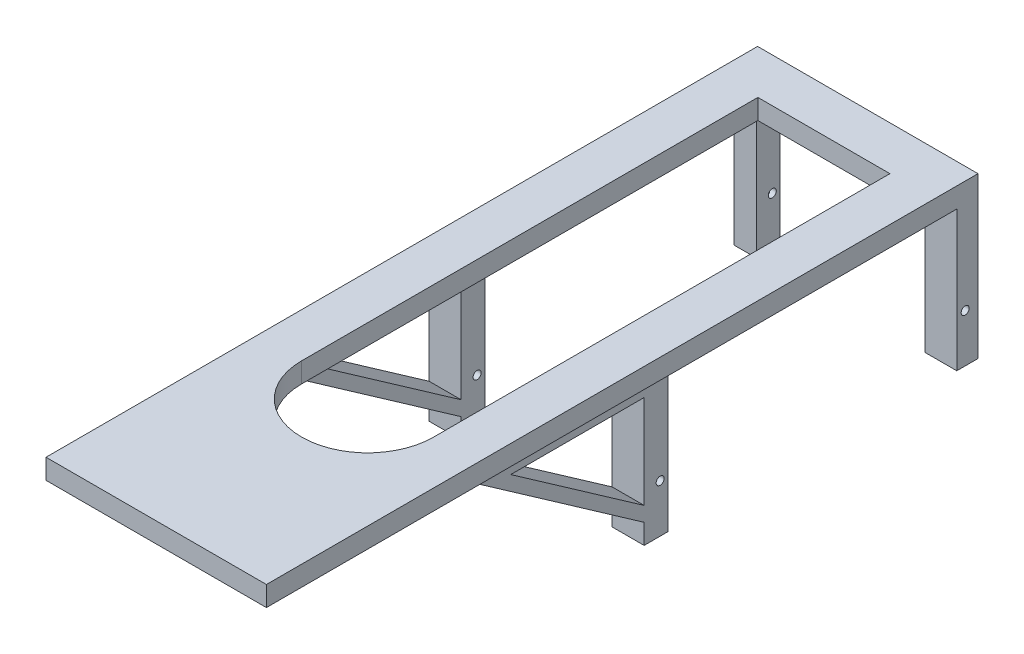
from build123d import *

# Parameters (mm, degrees)
ESQUISSE2_W             = 8
ESQUISSE2_H             = 5.3
BOSS_EXTRU_1_DEPTH      = 35
ESQUISSE2_W_2           = 5.6
ESQUISSE2_H_2           = 5.93
BOSS_EXTRU_1_2_DEPTH    = 35
ESQUISSE2_H_3           = 6
BOSS_EXTRU_1_3_DEPTH    = 35
BOSS_EXTRU_1_4_DEPTH    = 35
ESQUISSE3_W             = 55.06
ESQUISSE3_H             = 177.755
BOSS_EXTRU_2_DEPTH      = 5
ESQUISSE8_W             = 0.5
ESQUISSE8_H             = 25
ENL_V_MAT_EXTRU_3_DEPTH = 3.5
ESQUISSE9_W             = 25
ESQUISSE9_H             = 0.5
ENL_V_MAT_EXTRU_4_DEPTH = 3.5
BOSS_EXTRU_3_DEPTH      = 8
BOSS_EXTRU_4_DEPTH      = 8
ESQUISSE15_R            = 1.6
ENL_V_MAT_EXTRU_5_DEPTH = 15
ESQUISSE16_R            = 1
ENL_V_MAT_EXTRU_6_DEPTH = 9.6
ESQUISSE18_R            = 1
ENL_V_MAT_EXTRU_7_DEPTH = 9.6
ESQUISSE19_R            = 1
ENL_V_MAT_EXTRU_8_DEPTH = 128.416796915
ENL_V_MAT_EXTRU_9_REACH = 133.156


with BuildPart() as part:
    # Esquisse2 → Boss.-Extru.1 (new body)
    with BuildSketch(Plane(origin=(0, 0, 0), x_dir=(1, 0, 0), z_dir=(0, 1, 0))):
        with Locations((59.173, 105.105)):
            Rectangle(ESQUISSE2_W, ESQUISSE2_H)
    extrude(amount=BOSS_EXTRU_1_DEPTH)



with BuildPart() as body_2:
    # Esquisse2 → Boss.-Extru.1 2 (new body)
    with BuildSketch(Plane(origin=(0, 0, 0), x_dir=(1, 0, 0), z_dir=(0, 1, 0))):
        with Locations((10.913, 104.79)):
            Rectangle(ESQUISSE2_W_2, ESQUISSE2_H_2)
    extrude(amount=BOSS_EXTRU_1_2_DEPTH)


with BuildPart() as body_3:
    # Esquisse2 → Boss.-Extru.1 3 (new body)
    with BuildSketch(Plane(origin=(0, 0, 0), x_dir=(1, 0, 0), z_dir=(0, 1, 0))):
        with Locations((12.183, 28.625)):
            Rectangle(ESQUISSE2_W, ESQUISSE2_H_3)
    extrude(amount=BOSS_EXTRU_1_3_DEPTH)


with BuildPart() as body_4:
    # Esquisse2 → Boss.-Extru.1 4 (new body)
    with BuildSketch(Plane(origin=(0, 0, 0), x_dir=(1, 0, 0), z_dir=(0, 1, 0))):
        with Locations((57.903, 28.625)):
            Rectangle(ESQUISSE2_W, ESQUISSE2_H_3)
    extrude(amount=BOSS_EXTRU_1_4_DEPTH)


with BuildPart() as part_1:
    add(part.part)

    add(body_2.part)  # Boss.-Extru.2 merges body 2

    add(body_3.part)  # Boss.-Extru.2 merges body 3

    add(body_4.part)  # Boss.-Extru.2 merges body 4
    # Esquisse3 → Boss.-Extru.2 (add)
    with BuildSketch(Plane(origin=(0, 35, 0), x_dir=(1, 0, 0), z_dir=(0, 1, 0))):
        with Locations((35.643, 18.8775)):
            Rectangle(ESQUISSE3_W, ESQUISSE3_H)
    extrude(amount=BOSS_EXTRU_2_DEPTH)

    # Esquisse8 → Enlèv. mat.-Extru.3 (cut)
    with BuildSketch(Plane(origin=(0, 35, 0), x_dir=(1, 0, 0), z_dir=(0, 1, 0))):
        with Locations((54.923, -56.5)):
            Rectangle(ESQUISSE8_W, ESQUISSE8_H)
        with Locations((60.423, -56.5)):
            Rectangle(ESQUISSE8_W, ESQUISSE8_H)
        with Locations((49.423, -56.5)):
            Rectangle(ESQUISSE8_W, ESQUISSE8_H)
        with Locations((43.923, -56.5)):
            Rectangle(ESQUISSE8_W, ESQUISSE8_H)
        with Locations((38.423, -56.5)):
            Rectangle(ESQUISSE8_W, ESQUISSE8_H)
        with Locations((32.923, -56.5)):
            Rectangle(ESQUISSE8_W, ESQUISSE8_H)
        with Locations((27.423, -56.5)):
            Rectangle(ESQUISSE8_W, ESQUISSE8_H)
        with Locations((21.923, -56.5)):
            Rectangle(ESQUISSE8_W, ESQUISSE8_H)
        with Locations((16.423, -56.5)):
            Rectangle(ESQUISSE8_W, ESQUISSE8_H)
        with Locations((10.923, -56.5)):
            Rectangle(ESQUISSE8_W, ESQUISSE8_H)
    extrude(amount=ENL_V_MAT_EXTRU_3_DEPTH, mode=Mode.SUBTRACT)

    # Esquisse9 → Enlèv. mat.-Extru.4 (cut)
    with BuildSketch(Plane(origin=(0, 35, 0), x_dir=(1, 0, 0), z_dir=(0, 1, 0))):
        with Locations((49.673, -64.75)):
            Rectangle(ESQUISSE9_W, ESQUISSE9_H)
        with Locations((21.613, -64.75)):
            Rectangle(ESQUISSE9_W, ESQUISSE9_H)
        with Locations((49.673, -61.75)):
            Rectangle(ESQUISSE9_W, ESQUISSE9_H)
        with Locations((21.613, -61.75)):
            Rectangle(ESQUISSE9_W, ESQUISSE9_H)
        with Locations((49.673, -58.75)):
            Rectangle(ESQUISSE9_W, ESQUISSE9_H)
        with Locations((21.613, -58.75)):
            Rectangle(ESQUISSE9_W, ESQUISSE9_H)
        with Locations((49.673, -55.75)):
            Rectangle(ESQUISSE9_W, ESQUISSE9_H)
        with Locations((21.613, -55.75)):
            Rectangle(ESQUISSE9_W, ESQUISSE9_H)
        with Locations((49.673, -52.75)):
            Rectangle(ESQUISSE9_W, ESQUISSE9_H)
        with Locations((21.613, -52.75)):
            Rectangle(ESQUISSE9_W, ESQUISSE9_H)
        with Locations((49.673, -49.75)):
            Rectangle(ESQUISSE9_W, ESQUISSE9_H)
        with Locations((21.613, -49.75)):
            Rectangle(ESQUISSE9_W, ESQUISSE9_H)
        with Locations((49.673, -46.75)):
            Rectangle(ESQUISSE9_W, ESQUISSE9_H)
        with Locations((21.613, -46.75)):
            Rectangle(ESQUISSE9_W, ESQUISSE9_H)
    extrude(amount=ENL_V_MAT_EXTRU_4_DEPTH, mode=Mode.SUBTRACT)

    # Esquisse13 → Boss.-Extru.3 (add)
    with BuildSketch(Plane(origin=(61.903, 0, 0), x_dir=(0, 0, -1), z_dir=(1, 0, 0))):
        Polygon((25.625, 5), (-17.219440202, 35), (25.625, 35), align=None)
    extrude(amount=-BOSS_EXTRU_3_DEPTH)

    # Esquisse14 → Boss.-Extru.4 (add)
    with BuildSketch(Plane.ZY.offset(-8.183)):
        Polygon((-25.625, 5), (17.219440202, 35), (-25.625, 35), align=None)
    extrude(amount=-BOSS_EXTRU_4_DEPTH)

    # Esquisse15 → Enlèv. mat.-Extru.5 (cut)
    with BuildSketch(Plane(origin=(0, 0, 0), x_dir=(-1, 0, 0), z_dir=(0, -1, 0))):
        with Locations((-12.183, 29.625)):
            Circle(ESQUISSE15_R)
        with Locations((-57.903, 29.625)):
            Circle(ESQUISSE15_R)
        with Locations((-10.913, 105.825)):
            Circle(ESQUISSE15_R)
        with Locations((-59.173, 104.555)):
            Circle(ESQUISSE15_R)
    extrude(amount=-ENL_V_MAT_EXTRU_5_DEPTH, mode=Mode.SUBTRACT)

    # Esquisse16 → Enlèv. mat.-Extru.6 (cut)
    with BuildSketch(Plane.ZY.offset(-8.113)):
        with Locations((-105.825, 12)):
            Circle(ESQUISSE16_R)
    extrude(amount=-ENL_V_MAT_EXTRU_6_DEPTH, mode=Mode.SUBTRACT)

    # Esquisse18 → Enlèv. mat.-Extru.7 (cut)
    with BuildSketch(Plane(origin=(63.173, 0, 0), x_dir=(0, 0, -1), z_dir=(1, 0, 0))):
        with Locations((104.555, 12)):
            Circle(ESQUISSE18_R)
    extrude(amount=-ENL_V_MAT_EXTRU_7_DEPTH, mode=Mode.SUBTRACT)

    # Esquisse19 → Enlèv. mat.-Extru.8 (cut, through all)
    with BuildSketch(Plane.ZY.offset(-8.183)):
        with Locations((-29.625, 12)):
            Circle(ESQUISSE19_R)
        Polygon((-25.625, 8.662323766), (7.704655795, 32), (-25.625, 32), align=None)
    extrude(amount=-ENL_V_MAT_EXTRU_8_DEPTH, mode=Mode.SUBTRACT)

    # Esquisse20 → Enlèv. mat.-Extru.9 (cut, up to next)
    with BuildSketch(Plane(origin=(0, 40, 0), x_dir=(1, 0, 0), z_dir=(0, 1, 0)), mode=Mode.PRIVATE) as enl_v_mat_extru_9_sk1:
        with BuildLine():
            Line((19.183, 96.755), (52.173, 96.755))
            Line((52.173, 96.755), (52.173, -17.219440202))
            ThreePointArc((52.173, -17.219440202), (35.678, -33.714440202), (19.183, -17.219440202))
            Line((19.183, -17.219440202), (19.183, 96.755))
        make_face()
    enl_v_mat_extru_9_tool1 = extrude(enl_v_mat_extru_9_sk1.sketch, amount=-ENL_V_MAT_EXTRU_9_REACH, mode=Mode.PRIVATE) & part_1.part
    add(enl_v_mat_extru_9_tool1.solids().sort_by_distance((35.678, 40, -33.236816))[0], mode=Mode.SUBTRACT)


solid = part_1.part
